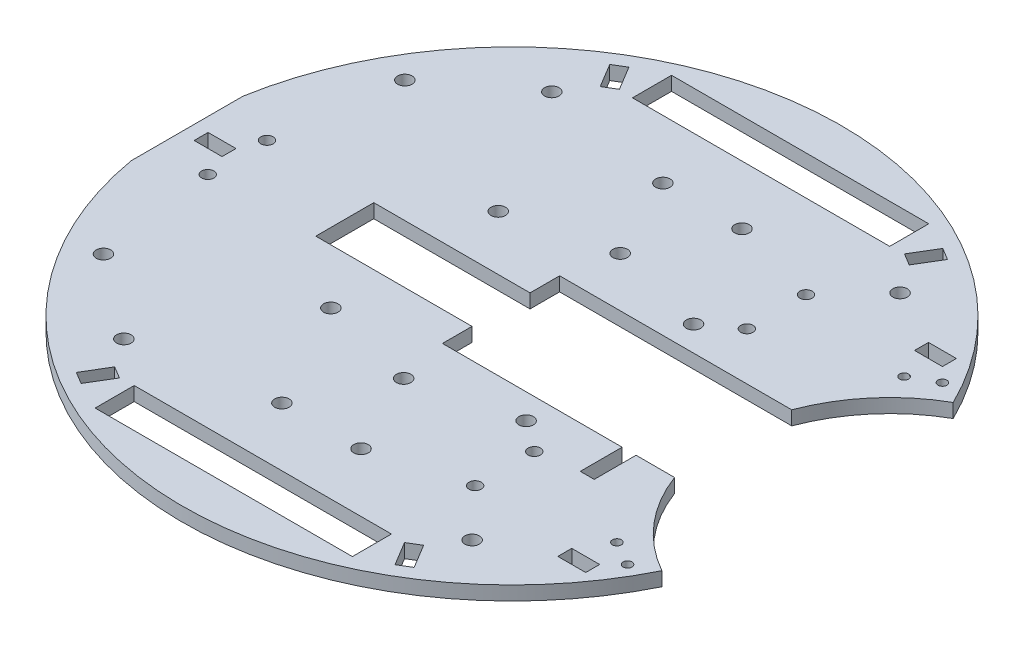
from build123d import *

# Parameters (mm, degrees)
SKETCH1_R           = 1.397
SKETCH1_R_2         = 1.651
SKETCH1_R_3         = 1.016
SKETCH1_W           = 58.544107304
SKETCH1_H           = 8.89
SKETCH1_W_2         = 6.35
SKETCH1_H_2         = 3.175
BOSS_EXTRUDE1_DEPTH = 3.175


with BuildPart() as part:
    # Sketch1 → Boss-Extrude1 (new body)
    with BuildSketch(Plane(origin=(0, 0, 0), x_dir=(1, 0, 0), z_dir=(0, 1, 0))):
        with BuildLine():
            Line((38.407265908, 13.335), (41.582265908, 13.335))
            Line((41.582265908, 13.335), (50.342102347, 13.335))
            ThreePointArc((50.342102347, 13.335), (57.058059725, 24.74076345), (67.270928268, 33.160552015))
            ThreePointArc((67.270928268, 33.160552015), (-10.756431789, 74.224653419), (-73.916912814, 12.7))
            Line((-73.916912814, 12.7), (-73.916912814, -12.7))
            ThreePointArc((-73.916912814, -12.7), (-10.756431789, -74.224653419), (67.270928268, -33.160552015))
            ThreePointArc((67.270928268, -33.160552015), (60.584216496, -28.355013333), (55.086193863, -22.225))
            ThreePointArc((55.086193863, -22.225), (52.41895011, -17.937530518), (50.342102347, -13.335))
            Line((50.342102347, -13.335), (46.281265908, -13.335))
            Line((46.281265908, -13.335), (41.582265908, -13.335))
            Line((41.582265908, -13.335), (41.582265908, -22.86))
            Line((41.582265908, -22.86), (38.407265908, -22.86))
            Line((38.407265908, -22.86), (38.407265908, -13.335))
            Line((38.407265908, -13.335), (-2.486734092, -13.335))
            Line((-2.486734092, -13.335), (-2.486734092, -6.604))
            Line((-2.486734092, -6.604), (-38.046734092, -6.604))
            Line((-38.046734092, -6.604), (-38.046734092, 6.604))
            Line((-38.046734092, 6.604), (-2.486734092, 6.604))
            Line((-2.486734092, 6.604), (-2.486734092, 13.335))
            Line((-2.486734092, 13.335), (38.407265908, 13.335))
        make_face()
        with Locations((-62.486912814, 6.731)):
            Circle(SKETCH1_R, mode=Mode.SUBTRACT)
        with Locations((-62.486912814, -6.731)):
            Circle(SKETCH1_R, mode=Mode.SUBTRACT)
        with Locations((-39.626912814, -48.698461806)):
            Circle(SKETCH1_R_2, mode=Mode.SUBTRACT)
        with Locations((39.626912814, -48.698461806)):
            Circle(SKETCH1_R_2, mode=Mode.SUBTRACT)
        with Locations((39.626912814, 48.698461806)):
            Circle(SKETCH1_R_2, mode=Mode.SUBTRACT)
        with Locations((0, -24.638)):
            Circle(SKETCH1_R_2, mode=Mode.SUBTRACT)
        with Locations((-39.626912814, 48.698461806)):
            Circle(SKETCH1_R_2, mode=Mode.SUBTRACT)
        with Locations((0, 24.638)):
            Circle(SKETCH1_R_2, mode=Mode.SUBTRACT)
        with Locations((29.272053652, -37.649461806)):
            Circle(SKETCH1_R, mode=Mode.SUBTRACT)
        with Locations((-58.676912814, 34.29)):
            Circle(SKETCH1_R_2, mode=Mode.SUBTRACT)
        with Locations((62.141053559, -35.830642926)):
            Circle(SKETCH1_R_3, mode=Mode.SUBTRACT)
        with Locations((56.570777105, -32.679132142)):
            Circle(SKETCH1_R_3, mode=Mode.SUBTRACT)
        with Locations((-58.676912814, -34.29)):
            Circle(SKETCH1_R_2, mode=Mode.SUBTRACT)
        with Locations((29.272053652, -24.187461806)):
            Circle(SKETCH1_R, mode=Mode.SUBTRACT)
        with Locations((29.272053652, 37.649461806)):
            Circle(SKETCH1_R, mode=Mode.SUBTRACT)
        with Locations((29.272053652, 24.187461806)):
            Circle(SKETCH1_R, mode=Mode.SUBTRACT)
        with Locations((8.99925, -43.353461806)):
            Circle(SKETCH1_R_2, mode=Mode.SUBTRACT)
        with Locations((-9.00075, -43.353461806)):
            Circle(SKETCH1_R_2, mode=Mode.SUBTRACT)
        with Locations((-9.00075, 43.353461806)):
            Circle(SKETCH1_R_2, mode=Mode.SUBTRACT)
        with Locations((8.99925, 43.353461806)):
            Circle(SKETCH1_R_2, mode=Mode.SUBTRACT)
        with Locations((62.141053559, 35.830642926)):
            Circle(SKETCH1_R_3, mode=Mode.SUBTRACT)
        with Locations((56.570777105, 32.679132142)):
            Circle(SKETCH1_R_3, mode=Mode.SUBTRACT)
        with Locations((22.278265908, 19.05)):
            Circle(SKETCH1_R_2, mode=Mode.SUBTRACT)
        with Locations((22.278265908, -19.05)):
            Circle(SKETCH1_R_2, mode=Mode.SUBTRACT)
        with Locations((-22.171734092, -19.05)):
            Circle(SKETCH1_R_2, mode=Mode.SUBTRACT)
        with Locations((-22.171734092, 19.05)):
            Circle(SKETCH1_R_2, mode=Mode.SUBTRACT)
        with Locations((0, -61.144461806)):
            Rectangle(SKETCH1_W, SKETCH1_H, mode=Mode.SUBTRACT)
        with Locations((0, 61.144461806)):
            Rectangle(SKETCH1_W, SKETCH1_H, mode=Mode.SUBTRACT)
        with Locations((55.791053559, -40.593142926)):
            Rectangle(SKETCH1_W_2, SKETCH1_H_2, mode=Mode.SUBTRACT)
        with Locations((55.791053559, 40.593142926)):
            Rectangle(SKETCH1_W_2, SKETCH1_H_2, mode=Mode.SUBTRACT)
        Polygon((32.44100721, -56.895314679), (35.719111901, -62.333745485), (38.438327304, -60.694693139), (35.160222613, -55.256262334), align=None, mode=Mode.SUBTRACT)
        Polygon((-32.44100721, -56.895314679), (-35.160222613, -55.256262334), (-38.438327304, -60.694693139), (-35.719111901, -62.333745485), align=None, mode=Mode.SUBTRACT)
        Polygon((-35.160222613, 55.256262334), (-38.438327304, 60.694693139), (-35.719111901, 62.333745485), (-32.44100721, 56.895314679), align=None, mode=Mode.SUBTRACT)
        Polygon((35.160222613, 55.256262334), (38.438327304, 60.694693139), (35.719111901, 62.333745485), (32.44100721, 56.895314679), align=None, mode=Mode.SUBTRACT)
        with Locations((-67.566912814, 0)):
            Rectangle(SKETCH1_W_2, SKETCH1_H_2, mode=Mode.SUBTRACT)
    extrude(amount=BOSS_EXTRUDE1_DEPTH)


solid = part.part
